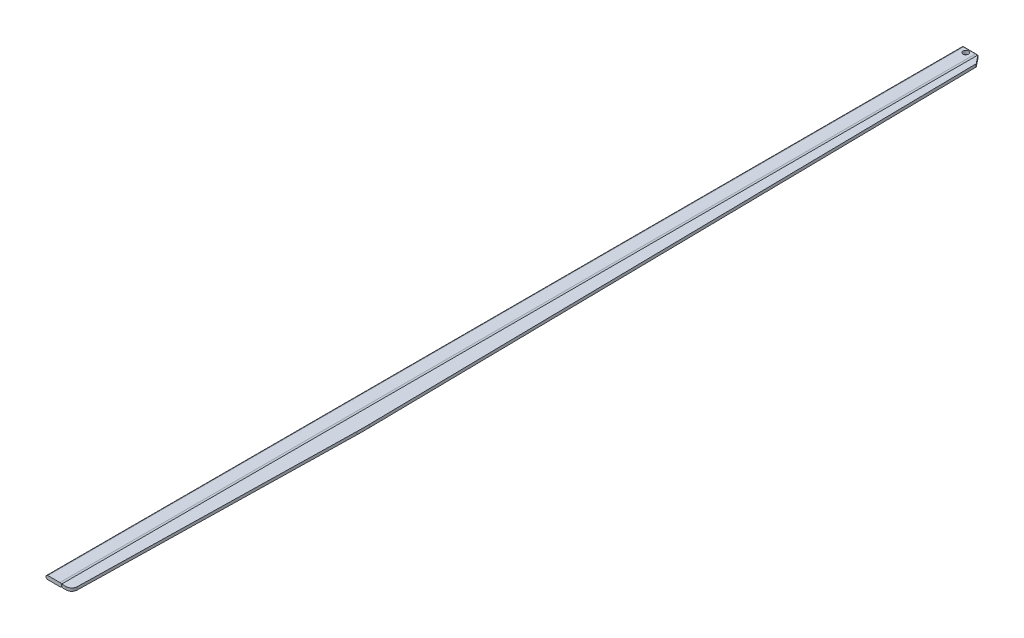
from build123d import *

# Parameters (mm, degrees)
SKETCH4_R                = 75
CUT_EXTRUDE1_DEPTH       = 25002.124474711
FILLET1_R                = 20
BOSS_EXTRUDE1_DEPTH      = 40
BOSS_EXTRUDE1_DEPTH_BACK = 40


with BuildPart() as part:
    # Sweep1: sweep along a path in Sketch2
    with BuildLine(Plane(origin=(0, 0, 0), x_dir=(1, 0, 0), z_dir=(0, 1, 0))) as sweep1_path:
        Line((0, 0), (0, -25000))
    # Sketch1 → Sweep1 (sweep)
    with BuildSketch(Plane.XY):
        with BuildLine():
            Line((-165, 50), (165, 50))
            ThreePointArc((165, 50), (215, 0), (165, -50))
            Line((165, -50), (-165, -50))
            ThreePointArc((-165, -50), (-215, 0), (-165, 50))
        make_face()
    sweep(path=sweep1_path.line)

    # Sketch4 → Cut-Extrude1 (cut, through all)
    with BuildSketch(Plane(origin=(0, 50, 0), x_dir=(1, 0, 0), z_dir=(0, 1, 0))):
        with Locations((0, -120)):
            Circle(SKETCH4_R)
    extrude(amount=-CUT_EXTRUDE1_DEPTH, mode=Mode.SUBTRACT)

    # Fillet1
    fillet1_edges = [part.edges().sort_by_distance(p)[0] for p in [
        (0, 50, 0),
        (215, 0, 0),
        (0, -50, 0),
        (-215, 0, 0),
    ]]
    fillet(fillet1_edges, radius=FILLET1_R)


with BuildPart() as body_2:
    # Sketch3 → Boss-Extrude1 (new, two sides: drawn at the far end of the back side and taken through both)
    with BuildSketch(Plane(origin=(0, 0, 0), x_dir=(1, 0, 0), z_dir=(0, 1, 0)).offset(-BOSS_EXTRUDE1_DEPTH_BACK)):
        with BuildLine():
            Line((215, 0), (395.715639997, -230.403641005))
            Line((395.715639997, -230.403641005), (638.142104005, -17026.186455561))
            ThreePointArc((638.142104005, -17026.186455561), (639.14881237, -17196.889950094), (637.241461224, -17367.58575707))
            Line((637.241461224, -17367.58575707), (489.671703659, -24854.069218784))
            ThreePointArc((489.671703659, -24854.069218784), (444.234848979, -24958.689275295), (338.35473686, -25001.107029186))
            Line((338.35473686, -25001.107029186), (215, -25000))
            Line((215, -25000), (215, 0))
        make_face()
    extrude(amount=BOSS_EXTRUDE1_DEPTH + BOSS_EXTRUDE1_DEPTH_BACK)


solid = Compound([part.part, body_2.part])
